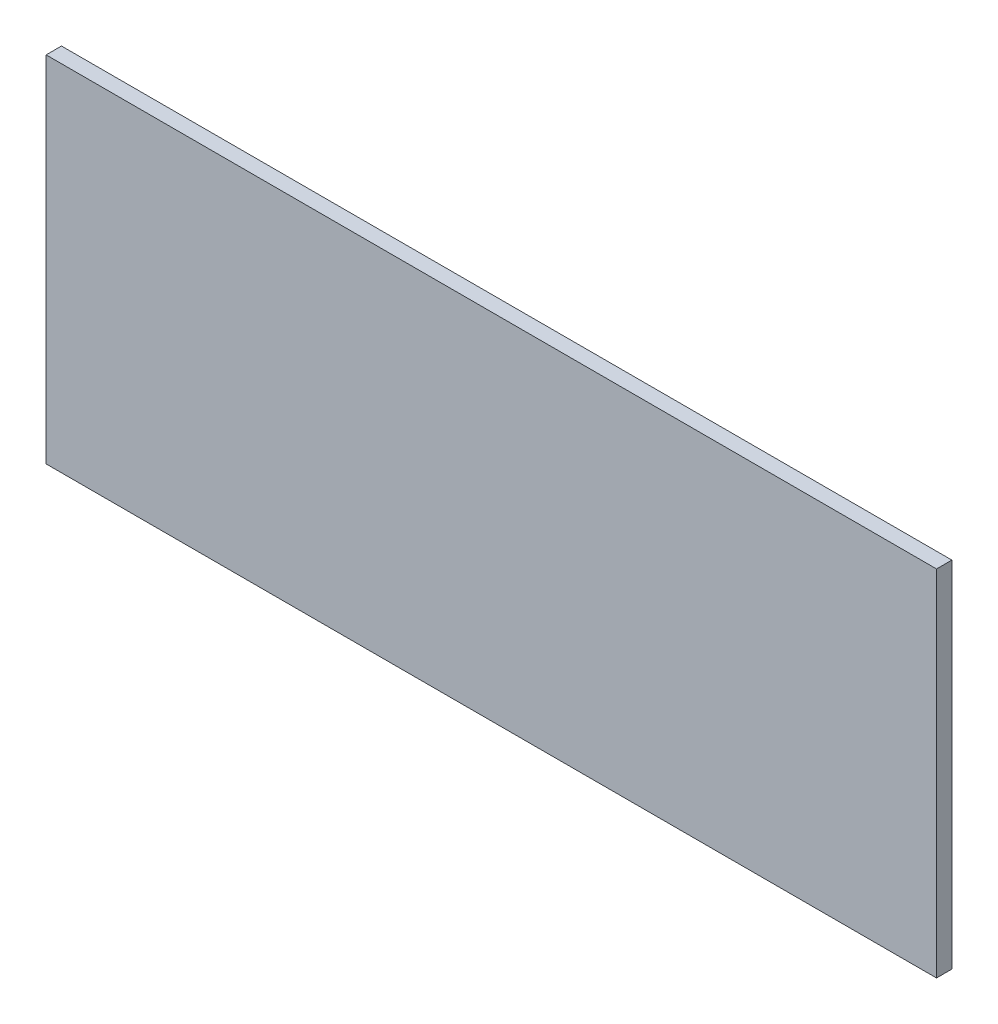
from build123d import *

# Parameters (mm, degrees)
ESQUISSE1_W        = 377
ESQUISSE1_H        = 150
BOSS_EXTRU_1_DEPTH = 6.5


with BuildPart() as part:
    # Esquisse1 → Boss.-Extru.1 (new body)
    with BuildSketch(Plane.XY):
        with Locations((-3.031306326, -52.107329843)):
            Rectangle(ESQUISSE1_W, ESQUISSE1_H)
    extrude(amount=BOSS_EXTRU_1_DEPTH)


solid = part.part
